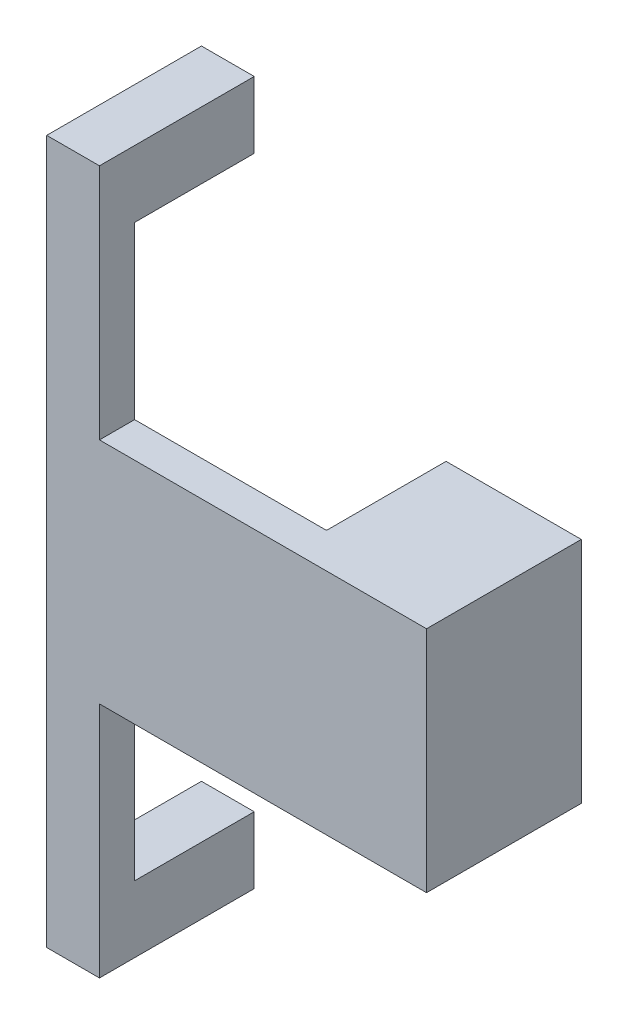
from build123d import *

# Parameters (mm, degrees)
SKETCH_1_W        = 7.689400099
SKETCH_1_H        = 13
EXTRUDE_1_DEPTH   = 8.8
SKETCH_1_W_2      = 3
SKETCH_1_H_2      = 3.788471525
EXTRUDE_1_2_DEPTH = 8.8
EXTRUDE_1_3_DEPTH = 8.8
EXTRUDE_2_DEPTH   = 2


with BuildPart() as part:
    # ｽｹｯﾁ1 → ﾎﾞｽ - 押し出し1 (new body)
    with BuildSketch(Plane.XY):
        with Locations((14.755299951, -6.5)):
            Rectangle(SKETCH_1_W, SKETCH_1_H)
    extrude(amount=-EXTRUDE_1_DEPTH)



with BuildPart() as body_2:
    # ｽｹｯﾁ1 → Extrude 1 2 (new body)
    with BuildSketch(Plane.XY):
        with Locations((-1.5, 11.605764238)):
            Rectangle(SKETCH_1_W_2, SKETCH_1_H_2)
    extrude(amount=-EXTRUDE_1_2_DEPTH)


with BuildPart() as body_3:
    # ｽｹｯﾁ1 → Extrude 1 3 (new body)
    with BuildSketch(Plane.XY):
        with Locations((-1.5, -24.605764238)):
            Rectangle(SKETCH_1_W_2, SKETCH_1_H_2)
    extrude(amount=-EXTRUDE_1_3_DEPTH)


with BuildPart() as part_1:
    add(part.part)

    add(body_2.part)  # ﾎﾞｽ - 押し出し2 merges body 2

    add(body_3.part)  # ﾎﾞｽ - 押し出し2 merges body 3
    # ｽｹｯﾁ2 → ﾎﾞｽ - 押し出し2 (add)
    with BuildSketch(Plane.XY):
        Polygon((0, -13), (18.6, -13), (18.6, 0), (0, 0), (0, 13.5), (-3, 13.5), (-3, -5.1), (-3, -7.9), (-3, -26.5), (0, -26.5), align=None)
    extrude(amount=-EXTRUDE_2_DEPTH)


solid = part_1.part
